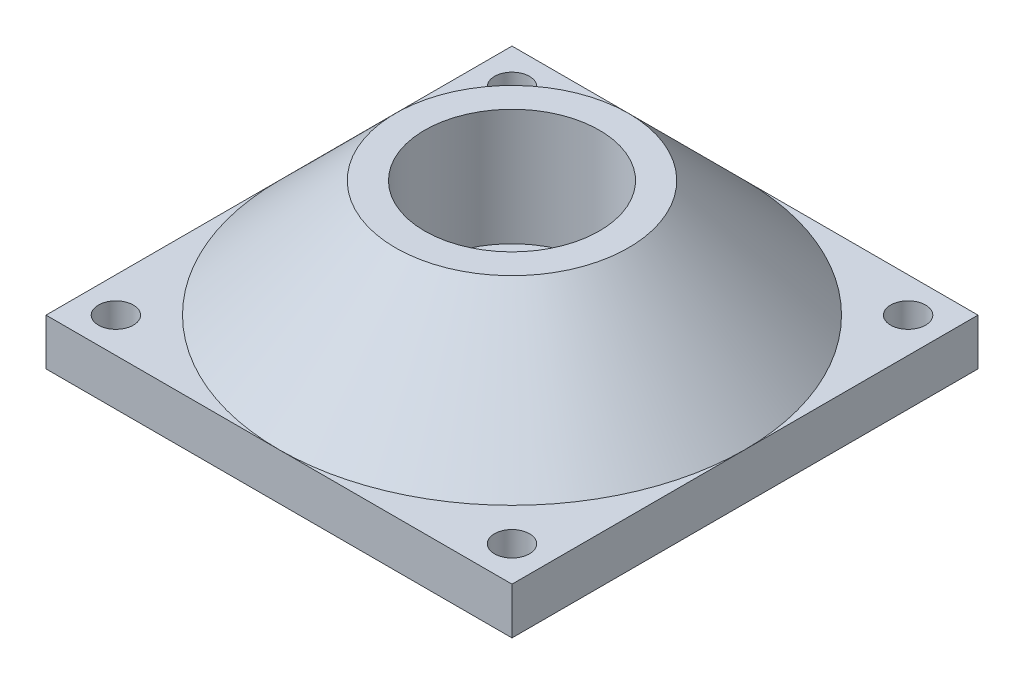
from build123d import *

# Parameters (mm, degrees)
SKIZZE1_W                       = 200
SKIZZE1_H                       = 200
AUFSATZ_LINEAR_AUSTRAGEN1_DEPTH = 20
SKIZZE2_R                       = 50
SKIZZE2_R_2                     = 37.5
AUFSATZ_LINEAR_AUSTRAGEN2_DEPTH = 50
FASE1_SIZE                      = 50
SKIZZE3_R                       = 7.5
SCHNITT_LINEAR_AUSTRAGEN1_DEPTH = 50


with BuildPart() as part:
    # Skizze1 → Aufsatz-Linear austragen1 (new body)
    with BuildSketch(Plane(origin=(0, 0, 0), x_dir=(1, 0, 0), z_dir=(0, 1, 0))):
        Rectangle(SKIZZE1_W, SKIZZE1_H)
    extrude(amount=AUFSATZ_LINEAR_AUSTRAGEN1_DEPTH)

    # Skizze2 → Aufsatz-Linear austragen2 (add)
    with BuildSketch(Plane(origin=(0, 20, 0), x_dir=(1, 0, 0), z_dir=(0, 1, 0))):
        with Locations(Location((0, 0, 0), (0, 0, 90))):
            Circle(SKIZZE2_R)
        with Locations(Location((0, 0, 0), (0, 0, 270))):
            Circle(SKIZZE2_R_2, mode=Mode.SUBTRACT)
    extrude(amount=AUFSATZ_LINEAR_AUSTRAGEN2_DEPTH)

    # Fase1
    fase1_edges = [part.edges().sort_by_distance(p)[0] for p in [
        (0, 20, 50),
    ]]
    chamfer(fase1_edges, length=FASE1_SIZE - 0.0001)  # a hair under: the kernel refuses the full size

    # Skizze3 → Schnitt-Linear austragen1 (cut)
    with BuildSketch(Plane(origin=(0, 20, 0), x_dir=(1, 0, 0), z_dir=(0, 1, 0))):
        with Locations(Location((85, 85, 0), (0, 0, 270))):
            Circle(SKIZZE3_R)
        with Locations(Location((-85, 85, 0), (0, 0, 90))):
            Circle(SKIZZE3_R)
        with Locations(Location((85, -85, 0), (0, 0, 90))):
            Circle(SKIZZE3_R)
        with Locations(Location((-85, -85, 0), (0, 0, 270))):
            Circle(SKIZZE3_R)
    extrude(amount=-SCHNITT_LINEAR_AUSTRAGEN1_DEPTH, mode=Mode.SUBTRACT)


solid = part.part
